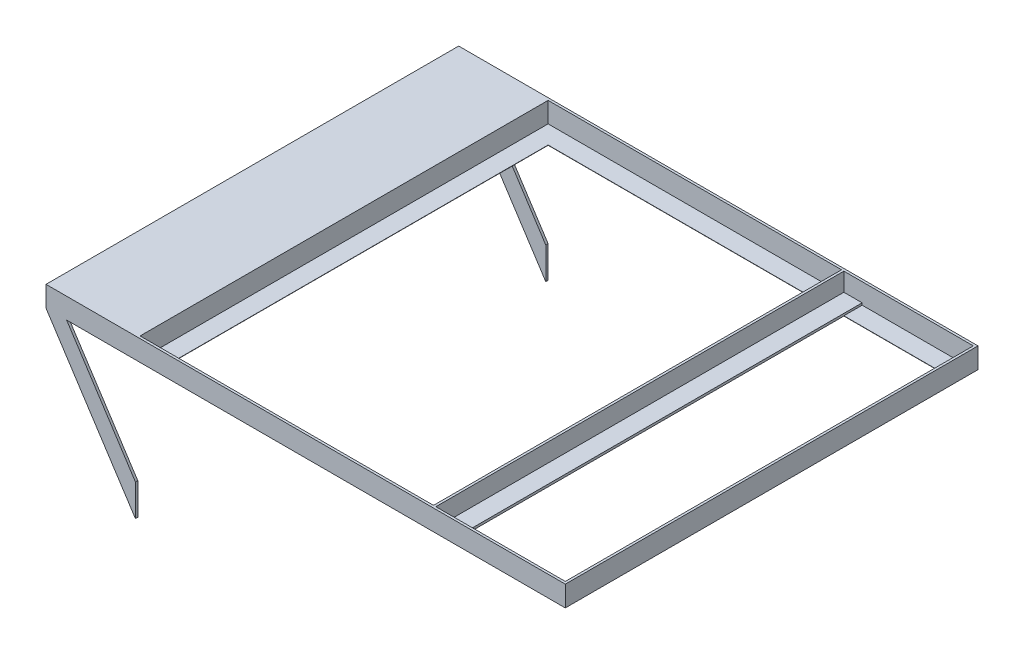
from build123d import *

# Parameters (mm, degrees)
SKETCH1_W           = 755
SKETCH1_H           = 600
BOSS_EXTRUDE1_DEPTH = 30
CUT_EXTRUDE2_DEPTH  = 29.6
SKETCH5_W           = 565
SKETCH5_H           = 540
CUT_EXTRUDE3_DEPTH  = 29.6
BOSS_EXTRUDE2_DEPTH = 600
BOSS_EXTRUDE4_DEPTH = 3.4
BOSS_EXTRUDE5_DEPTH = 3.4


with BuildPart() as part:
    # Sketch1 → Boss-Extrude1 (new body)
    with BuildSketch(Plane(origin=(0, 0, 0), x_dir=(1, 0, 0), z_dir=(0, 1, 0))):
        Rectangle(SKETCH1_W, SKETCH1_H)
    extrude(amount=BOSS_EXTRUDE1_DEPTH)

    # Sketch3 → Cut-Extrude2 (cut)
    with BuildSketch(Plane(origin=(0, 30, 0), x_dir=(1, 0, 0), z_dir=(0, 1, 0))):
        Polygon((212.5, 296.6), (-244.1, 296.6), (-244.1, -296.6), (212.5, -296.6), (374.1, -296.6), (374.1, 296.6), align=None)
    extrude(amount=-CUT_EXTRUDE2_DEPTH, mode=Mode.SUBTRACT)

    # Sketch5 → Cut-Extrude3 (cut)
    with BuildSketch(Plane(origin=(0, 0.4, 0), x_dir=(1, 0, 0), z_dir=(0, 1, 0))):
        with Locations((65, 0)):
            Rectangle(SKETCH5_W, SKETCH5_H)
    extrude(amount=-CUT_EXTRUDE3_DEPTH, mode=Mode.SUBTRACT)

    # Sketch6 → Boss-Extrude2 (add)
    with BuildSketch(Plane.XY.offset(300)):
        Polygon((182.5, 30), (182.5, 0), (212.5, 0), (212.5, 3.4), (185.9, 3.4), (185.9, 30), align=None)
    extrude(amount=-BOSS_EXTRUDE2_DEPTH)

    # Sketch11 → Boss-Extrude4 (add)
    with BuildSketch(Plane.XY.offset(300)):
        Polygon((-377.5, 0), (-247.5, -200), (-247.5, -153.846153846), (-347.5, 0), align=None)
    extrude(amount=-BOSS_EXTRUDE4_DEPTH)

    # Sketch13 → Boss-Extrude5 (add)
    with BuildSketch(Plane(origin=(0, 0, -300), x_dir=(-1, 0, 0), z_dir=(0, 0, -1))):
        Polygon((377.5, 0), (347.5, 0), (247.5, -153.846153846), (247.5, -200), align=None)
    extrude(amount=-BOSS_EXTRUDE5_DEPTH)


solid = part.part
